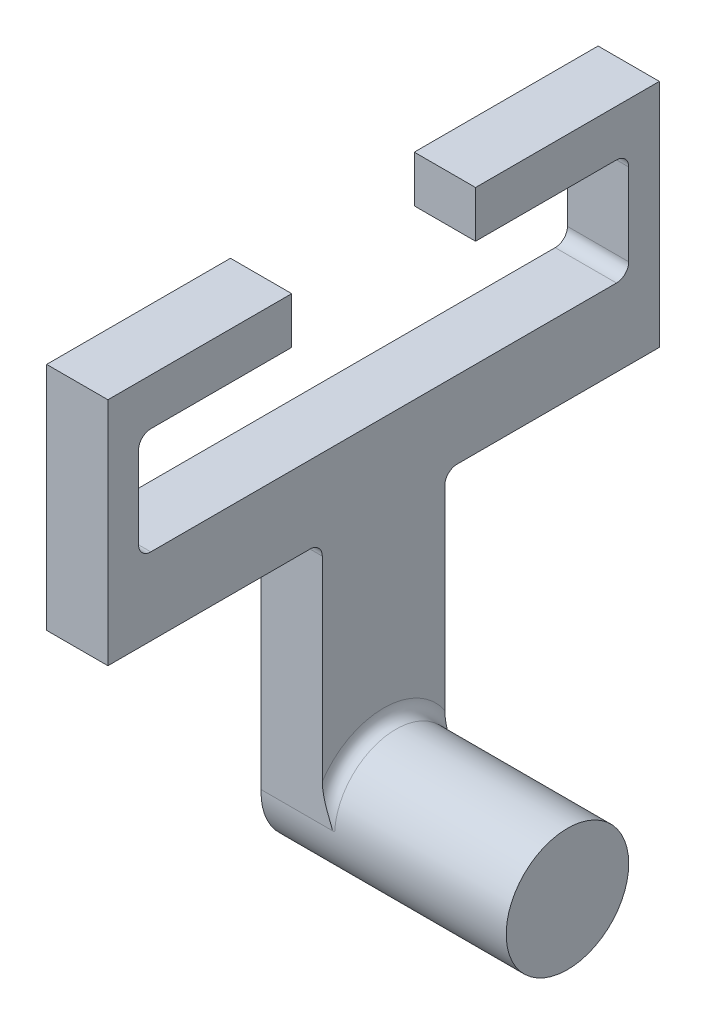
from build123d import *

# Parameters (mm, degrees)
SKETCH2_R           = 12.7
BOSS_EXTRUDE1_DEPTH = 50.8
SKETCH3_W           = 25.4
SKETCH3_H           = 50.8
BOSS_EXTRUDE2_DEPTH = 12.7
SKETCH5_W           = 101.6
SKETCH5_H           = 16.002
BOSS_EXTRUDE3_DEPTH = 12.7
SKETCH6_W           = 6.35
SKETCH6_H           = 38.1
BOSS_EXTRUDE4_DEPTH = 12.7
SKETCH7_W           = 38.1
SKETCH7_H           = 9.652
BOSS_EXTRUDE5_DEPTH = 12.7
FILLET1_R           = 2.54


with BuildPart() as part:
    # Sketch2 → Boss-Extrude1 (new body)
    with BuildSketch(Plane(origin=(0, 0, 0), x_dir=(0, 0, -1), z_dir=(1, 0, 0))):
        Circle(SKETCH2_R)
    extrude(amount=BOSS_EXTRUDE1_DEPTH)

    # Sketch3 → Boss-Extrude2 (add)
    with BuildSketch(Plane.ZY):
        with Locations((0.014597196, 26.008732875)):
            Rectangle(SKETCH3_W, SKETCH3_H)
    extrude(amount=-BOSS_EXTRUDE2_DEPTH)


with BuildPart() as body_2:
    # Sketch5 → Boss-Extrude3 (new body)
    with BuildSketch(Plane(origin=(0, 0, 0), x_dir=(0, 0, -1), z_dir=(1, 0, 0))):
        with Locations((0, 59.392294155)):
            Rectangle(SKETCH5_W, SKETCH5_H)
    extrude(amount=BOSS_EXTRUDE3_DEPTH)

    # Sketch6 → Boss-Extrude4 (add)
    with BuildSketch(Plane(origin=(0, 0, 0), x_dir=(0, 0, -1), z_dir=(1, 0, 0))):
        with Locations((-53.975, 70.441294155)):
            Rectangle(SKETCH6_W, SKETCH6_H)
        with Locations((53.975, 70.441294155)):
            Rectangle(SKETCH6_W, SKETCH6_H)
    extrude(amount=BOSS_EXTRUDE4_DEPTH)

    # Sketch7 → Boss-Extrude5 (add)
    with BuildSketch(Plane(origin=(0, 0, 0), x_dir=(0, 0, -1), z_dir=(1, 0, 0))):
        with Locations((-38.1, 94.317294155)):
            Rectangle(SKETCH7_W, SKETCH7_H)
        with Locations((38.1, 94.317294155)):
            Rectangle(SKETCH7_W, SKETCH7_H)
    extrude(amount=BOSS_EXTRUDE5_DEPTH)


with BuildPart() as part_1:
    add(part.part)

    # Combine1: union body 2
    add(body_2.part)

    # Fillet1
    # the kernel refuses this fillet: 2.54 mm, written as the material it adds along each edge
    with BuildSketch(Plane(origin=(12.7, 51.391294155, 12.714597196), x_dir=(0, -1, 0), z_dir=(-1, 0, 0)), Plane(origin=(0, 51.391294155, -12.685402804), x_dir=(0, -1, 0), z_dir=(1, 0, 0)), Plane(origin=(0, 67.393294155, -50.8), x_dir=(0, 1, 0), z_dir=(1, 0, 0))) as fillet1_piece_1:
        with BuildLine():
            CenterArc((FILLET1_R, FILLET1_R), FILLET1_R, 180, 90)
            Line((0, FILLET1_R), (0, 0))
            Line((0, 0), (FILLET1_R, 0))
        make_face()
    extrude(amount=12.7)
    with BuildSketch(Plane(origin=(12.7, 0, 0), x_dir=(0, -0.4374901189408423, 0.8992232180216032), z_dir=(0, -0.8992232180216032, -0.4374901189408423))) as fillet1_piece_2_section:
        with BuildLine():
            CenterArc((12.7 + FILLET1_R, -FILLET1_R), FILLET1_R, 90, 90)
            Line((12.7 + FILLET1_R, 0), (12.7, 0))
            Line((12.7, 0), (12.7, -FILLET1_R))
        make_face()
    fillet1_piece_2 = revolve(axis=Axis((12.7, 0, 0), (-1, 0, 0)), revolution_arc=231.887700359, mode=Mode.PRIVATE)
    fillet1_piece_2 = split(fillet1_piece_2, bisect_by=Plane(origin=(13.416714054, 13.416714034, -12.685402804), z_dir=(0, 0, 1)), keep=Keep.TOP, mode=Mode.PRIVATE)
    fillet1_piece_2 = split(fillet1_piece_2, bisect_by=Plane(origin=(13.416714054, 0.608732875, 0.00073746), z_dir=(0, 1, 0)), keep=Keep.TOP, mode=Mode.PRIVATE)
    fillet1_piece_2 = split(fillet1_piece_2, bisect_by=Plane(origin=(13.416714054, 13.416714034, 12.714597196), z_dir=(0, 0, -1)), keep=Keep.TOP, mode=Mode.PRIVATE)
    add(fillet1_piece_2)
    with BuildSketch(Plane(origin=(0, 89.491294155, -50.8), x_dir=(0, -1, 0), z_dir=(1, 0, 0)), Plane(origin=(0, 89.491294155, 50.8), x_dir=(0, 0, -1), z_dir=(1, 0, 0)), Plane(origin=(0, 67.393294155, 50.8), x_dir=(0, 1, 0), z_dir=(1, 0, 0))) as fillet1_piece_3:
        with BuildLine():
            CenterArc((FILLET1_R, -FILLET1_R), FILLET1_R, 90, 90)
            Line((0, -FILLET1_R), (0, 0))
            Line((0, 0), (FILLET1_R, 0))
        make_face()
    extrude(amount=12.7)


solid = part_1.part
